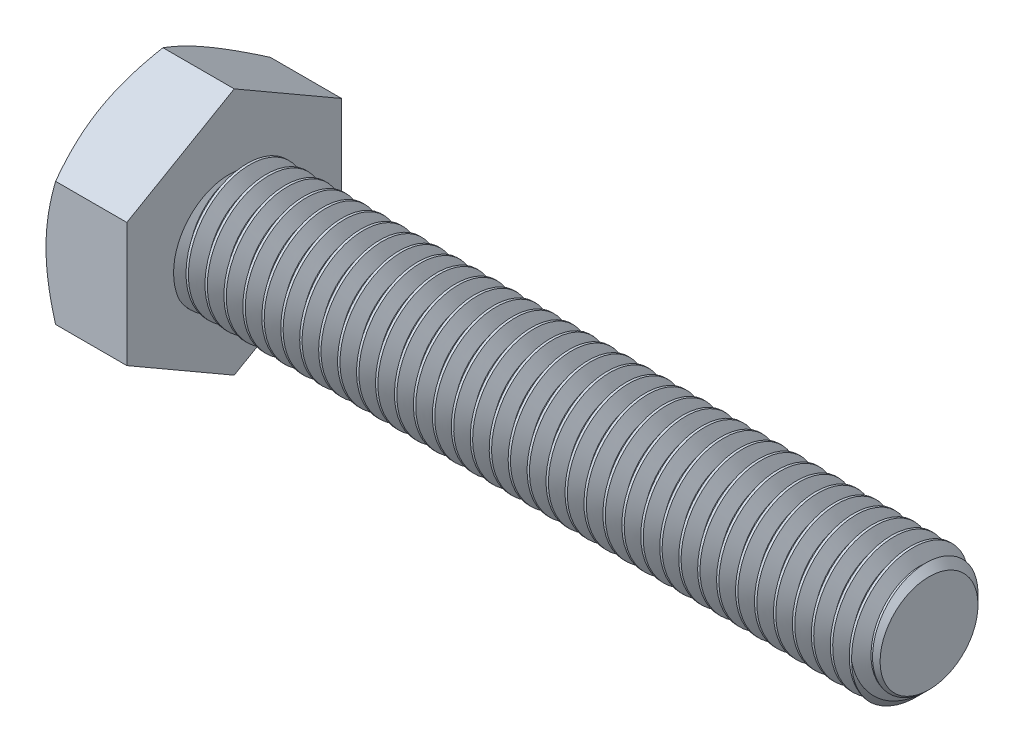
from build123d import *

# Parameters (mm, degrees)
SKETCH2_R           = 5
BOSS_EXTRUDE1_DEPTH = 55
CHAMFER1_SIZE       = 1.125
CUT_SWEEP1_PITCH    = 1.5
BOSS_EXTRUDE2_DEPTH = 6.4
SKETCH6_OUTSIDE_W   = 253.196
SKETCH6_OUTSIDE_H   = 255.826
SKETCH6_OUTSIDE_R   = 8.5
CUT_EXTRUDE1_DEPTH  = 63.757815045
CUT_EXTRUDE1_DRAFT  = -60


with BuildPart() as part:
    # Sketch2 → Boss-Extrude1 (new body)
    with BuildSketch(Plane(origin=(30.7, 0, 0), x_dir=(0, 0, -1), z_dir=(1, 0, 0))):
        Circle(SKETCH2_R)
    extrude(amount=-BOSS_EXTRUDE1_DEPTH)

    # Chamfer1
    chamfer1_edges = [part.edges().sort_by_distance(p)[0] for p in [
        (30.7, 0, 5),
    ]]
    chamfer(chamfer1_edges, length=CHAMFER1_SIZE)

    # Cut-Sweep1: arcs per turn and ends read off the stored shape
    # Cut-Sweep1: the profile of Sketch5 profile screwed along a right-hand helix through 37.666667 turns, 8 arcs to a turn; built about Z, then put on its axis
    cut_sweep1_z = Axis((0, 0, 0), (0, 0, 1))
    cut_sweep1_corners = [(5.0003, 0, 0.000173205), (4.025721421, 0, -0.5625), (4.025721421, 0, -0.75), (5.0003, 0, -1.312673205)]
    with BuildLine(mode=Mode.PRIVATE) as cut_sweep1_profile:
        Line(cut_sweep1_corners[0], cut_sweep1_corners[1])
        Line(cut_sweep1_corners[1], cut_sweep1_corners[2])
        Line(cut_sweep1_corners[2], cut_sweep1_corners[3])
        Line(cut_sweep1_corners[3], cut_sweep1_corners[0])
    cut_sweep1_cap = Face(cut_sweep1_profile.wire())
    cut_sweep1_turn_angles = [0, 22.5, 45, 67.5, 90, 112.5, 135, 157.5, 180, 202.5, 225, 247.5, 270, 292.5, 315, 337.5, 360]
    cut_sweep1_turn_weights = [1, 0.9238795325112867, 1, 0.9238795325112867, 1, 0.9238795325112867, 1, 0.9238795325112867, 1, 0.9238795325112867, 1, 0.9238795325112867, 1, 0.9238795325112867, 1, 0.9238795325112867, 1]
    cut_sweep1_turn_rails = [Edge.make_bspline([Vector(p[0], p[1], 0).rotate(cut_sweep1_z, cut_sweep1_turn_angles[k]) / cut_sweep1_turn_weights[k] + Vector(0, 0, p[2] + CUT_SWEEP1_PITCH * cut_sweep1_turn_angles[k] / 360) for k in range(17)], [0, 0, 0, 1, 1, 2, 2, 3, 3, 4, 4, 5, 5, 6, 6, 7, 7, 8, 8, 8], 2, cut_sweep1_turn_weights) for p in cut_sweep1_corners]
    cut_sweep1_turn_sides = [Face.make_surface_from_curves(cut_sweep1_turn_rails[p[0]], cut_sweep1_turn_rails[p[1]]) for p in [(0, 1), (1, 2), (2, 3), (3, 0)]]
    cut_sweep1_last_angles = [13320, 13342.5, 13365, 13387.5, 13410, 13432.5, 13455, 13477.5, 13500, 13522.5, 13545, 13552.5, 13560]
    cut_sweep1_last_weights = [1, 0.9238795325112867, 1, 0.9238795325112867, 1, 0.9238795325112867, 1, 0.9238795325112867, 1, 0.9238795325112867, 1, 0.9914448613738788, 1]
    cut_sweep1_last_rails = [Edge.make_bspline([Vector(p[0], p[1], 0).rotate(cut_sweep1_z, cut_sweep1_last_angles[k]) / cut_sweep1_last_weights[k] + Vector(0, 0, p[2] + CUT_SWEEP1_PITCH * cut_sweep1_last_angles[k] / 360) for k in range(13)], [0, 0, 0, 1, 1, 2, 2, 3, 3, 4, 4, 5, 5, 6, 6, 6], 2, cut_sweep1_last_weights) for p in cut_sweep1_corners]
    cut_sweep1_last_sides = [Face.make_surface_from_curves(cut_sweep1_last_rails[p[0]], cut_sweep1_last_rails[p[1]]) for p in [(0, 1), (1, 2), (2, 3), (3, 0)]]
    cut_sweep1 = Plane(origin=(30.7, 0, 0), x_dir=(0, 1, 0), z_dir=(-1, 0, 0)) * Solid(Shell([*[p.moved(Location((0, 0, CUT_SWEEP1_PITCH * i))) for i in range(37) for p in cut_sweep1_turn_sides], *cut_sweep1_last_sides, cut_sweep1_cap, cut_sweep1_cap.rotate(cut_sweep1_z, 13560).moved(Location((0, 0, CUT_SWEEP1_PITCH * 13560 / 360)))]))
    add(cut_sweep1, mode=Mode.SUBTRACT)

    # Sketch3 → Boss-Extrude2 (add)
    with BuildSketch(Plane.ZY.offset(24.3)):
        Polygon((-8.5, -4.907477288), (0, -9.814954576), (8.5, -4.907477288), (8.5, 4.907477288), (0, 9.814954576), (-8.5, 4.907477288), align=None)
    extrude(amount=BOSS_EXTRUDE2_DEPTH)


with BuildPart() as cut_extrude1_tool:
    # Sketch6 outside → Cut-Extrude1 (with draft: the straight prism first)
    with BuildSketch(Plane.ZY.offset(30.7)):
        Rectangle(SKETCH6_OUTSIDE_W, SKETCH6_OUTSIDE_H)
        Circle(SKETCH6_OUTSIDE_R, mode=Mode.SUBTRACT)
    extrude(amount=-CUT_EXTRUDE1_DEPTH)
    # Cut-Extrude1: the draft: its side faces are tilted about the plane it starts from
    cut_extrude1_sides = [cut_extrude1_tool.faces().sort_by_distance(p)[0] for p in [
        (1.178907523, -127.913, 0),
        (1.178907523, 0, 126.598),
        (1.178907523, 127.913, 0),
        (1.178907523, 0, -126.598),
        (1.178907523, 0, -8.5),
    ]]
    draft(cut_extrude1_sides, Plane.ZY.offset(30.7), CUT_EXTRUDE1_DRAFT)


with BuildPart() as part_1:
    add(part.part)

    # Cut-Extrude1: cut by cut_extrude1_tool
    add(cut_extrude1_tool.part, mode=Mode.SUBTRACT)


solid = part_1.part
